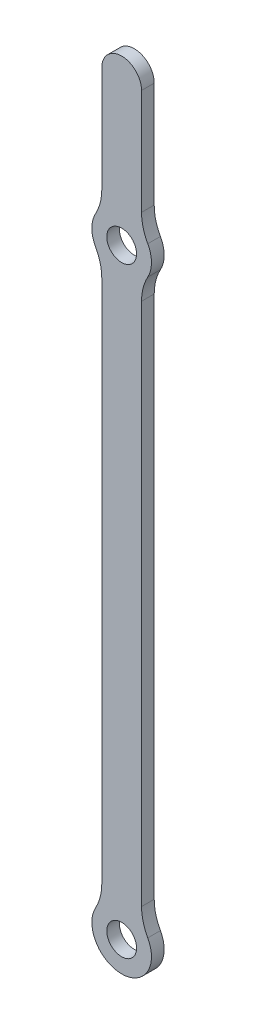
from build123d import *

# Parameters (mm, degrees)
MODEL_R             = 3
BOSS_EXTRUDE1_DEPTH = 2.55


with BuildPart() as part:
    # Model → Boss-Extrude1 (new body)
    with BuildSketch(Plane.XY):
        with BuildLine():
            Line((-4, 8.512011392), (-4, 7.745966692))
            ThreePointArc((-4, 7.745966692), (-4.317541634, 5.245966692), (-5.25, 2.90473751))
            ThreePointArc((-5.25, 2.90473751), (0, -6), (5.25, 2.90473751))
            ThreePointArc((5.25, 2.90473751), (4.317541634, 5.245966692), (4, 7.745966692))
            Line((4, 7.745966692), (4, 8.785724032))
            Line((4, 8.785724032), (4, 113.254033308))
            ThreePointArc((4, 113.254033308), (4.317541634, 115.754033308), (5.25, 118.09526249))
            ThreePointArc((5.25, 118.09526249), (6, 121), (5.25, 123.90473751))
            ThreePointArc((5.25, 123.90473751), (4.317541634, 126.245966692), (4, 128.745966692))
            Line((4, 128.745966692), (4, 150))
            ThreePointArc((4, 150), (0, 154), (-4, 150))
            Line((-4, 150), (-4, 128.745966692))
            ThreePointArc((-4, 128.745966692), (-4.317541634, 126.245966692), (-5.25, 123.90473751))
            ThreePointArc((-5.25, 123.90473751), (-6, 121), (-5.25, 118.09526249))
            ThreePointArc((-5.25, 118.09526249), (-4.317541634, 115.754033308), (-4, 113.254033308))
            Line((-4, 113.254033308), (-4, 8.512011392))
        make_face()
        Circle(MODEL_R, mode=Mode.SUBTRACT)
        with Locations((0, 121)):
            Circle(MODEL_R, mode=Mode.SUBTRACT)
    extrude(amount=BOSS_EXTRUDE1_DEPTH)


solid = part.part
